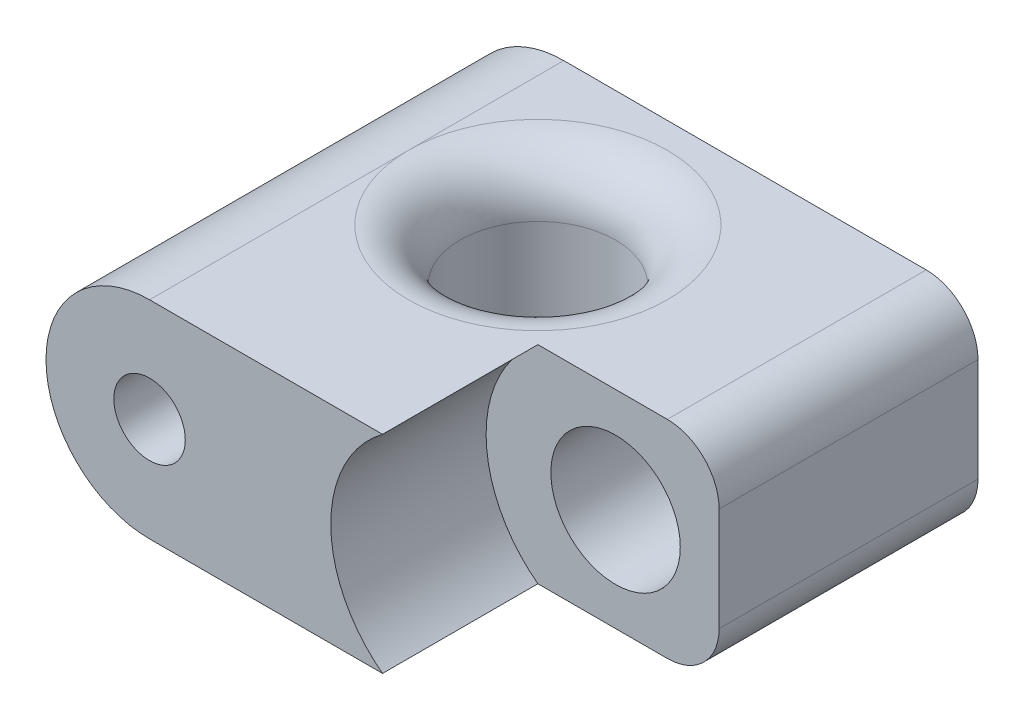
from build123d import *

# Parameters (mm, degrees)
SKETCH2_W                   = 10.16
SKETCH2_H                   = 10.16
EXTRUDE2_DEPTH              = 20.32
FILLET1_R                   = 2.54
SKETCH5_W                   = 20.32
SKETCH5_H                   = 10.16
EXTRUDE3_DEPTH              = 15.24
FILLET3_R                   = 5.08
SKETCH9_R                   = 3.81
CUT_EXTRUDE1_DEPTH          = 35.077675977
FILLET4_R                   = 2.54
SKETCH10_R                  = 6.35
CUT_EXTRUDE2_DEPTH          = 7.62
F_1_4_0_25_DIAMETER_HOLE1_D = 6.35
F_6_32_TAPPED_HOLE1_D       = 3.5052


with BuildPart() as part:
    # Sketch2 → Extrude2 (new body)
    with BuildSketch(Plane.XY):
        with Locations((-5.08, 5.08)):
            Rectangle(SKETCH2_W, SKETCH2_H)
    extrude(amount=EXTRUDE2_DEPTH)

    # Fillet1
    fillet1_edges = [part.edges().sort_by_distance(p)[0] for p in [
        (0, 0, 10.16),
        (0, 10.16, 10.16),
    ]]
    fillet(fillet1_edges, radius=FILLET1_R)

    # Sketch5 → Extrude3 (add)
    with BuildSketch(Plane.ZY.offset(10.16)):
        with Locations((10.16, 5.08)):
            Rectangle(SKETCH5_W, SKETCH5_H)
    extrude(amount=EXTRUDE3_DEPTH)

    # Fillet3
    fillet3_edges = [part.edges().sort_by_distance(p)[0] for p in [
        (-25.4, 0, 10.16),
        (-25.4, 10.16, 10.16),
    ]]
    fillet(fillet3_edges, radius=FILLET3_R - 0.0001)  # a hair under: the kernel refuses the full size

    # Sketch9 → Cut-Extrude1 (cut, through all)
    with BuildSketch(Plane(origin=(0, 10.16, 0), x_dir=(-1, 0, 0), z_dir=(0, 1, 0))):
        with Locations((13.97, 7.62)):
            Circle(SKETCH9_R)
    extrude(amount=-CUT_EXTRUDE1_DEPTH, mode=Mode.SUBTRACT)

    # Fillet4
    fillet4_edges = [part.edges().sort_by_distance(p)[0] for p in [
        (-10.16, 0, 7.62),
        (-10.16, 10.16, 7.62),
    ]]
    fillet(fillet4_edges, radius=FILLET4_R)

    # Sketch10 → Cut-Extrude2 (cut)
    with BuildSketch(Plane.XY.offset(20.32)):
        with Locations((-5.08, 5.08)):
            Circle(SKETCH10_R)
    extrude(amount=-CUT_EXTRUDE2_DEPTH, mode=Mode.SUBTRACT)

    # 1/4 (0.25) Diameter Hole1 (through all)
    with Locations(Plane(origin=(-5.08, 5.047963929, 12.7), x_dir=(1, 0, 0), z_dir=(0, 0, 1))):
        with Locations((0, 0)):
            Hole(F_1_4_0_25_DIAMETER_HOLE1_D / 2)

    # #6-32 Tapped Hole1 (through all)
    with Locations(Plane(origin=(-20.32, 5.08, 20.32), x_dir=(1, 0, 0), z_dir=(0, 0, 1))):
        with Locations((0, 0)):
            Hole(F_6_32_TAPPED_HOLE1_D / 2)


solid = part.part
